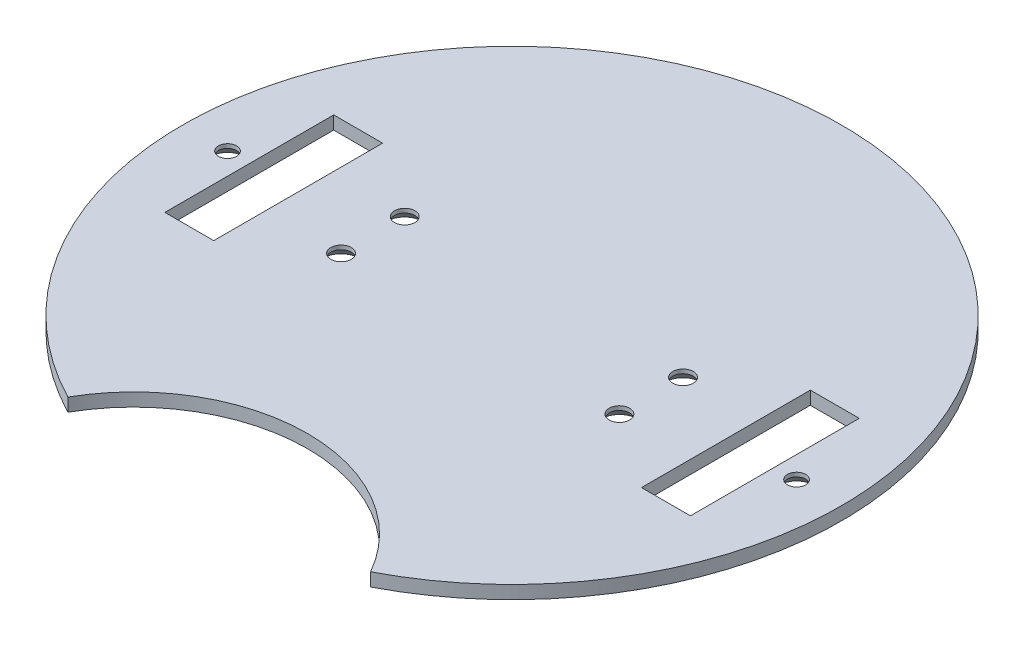
from build123d import *
from OCP.BRepFilletAPI import BRepFilletAPI_MakeChamfer

# Parameters (mm, degrees)
BOSS_EXTRUDE1_DEPTH = 2.9
SKETCH2_W           = 10.76
SKETCH2_H           = 37.139097212
CUT_EXTRUDE1_DEPTH  = 103.571487266
SKETCH3_R           = 2
SKETCH3_R_2         = 2.25
CUT_EXTRUDE2_DEPTH  = 103.571487266
CHAMFER1_SIZE       = 2
CHAMFER1_SIZE2      = 1.738573476


with BuildPart() as part:
    # Sketch1 → Boss-Extrude1 (new body)
    with BuildSketch(Plane(origin=(0, 0, 0), x_dir=(1, 0, 0), z_dir=(0, 1, 0))):
        with BuildLine():
            ThreePointArc((33.29110537, -64.404598464), (0, 72.5), (-33.29110537, -64.404598464))
            ThreePointArc((-33.29110537, -64.404598464), (0, -44.989799638), (33.29110537, -64.404598464))
        make_face()
    extrude(amount=BOSS_EXTRUDE1_DEPTH)

    # Sketch2 → Cut-Extrude1 (cut, through all)
    with BuildSketch(Plane(origin=(0, 2.9, 0), x_dir=(1, 0, 0), z_dir=(0, 1, 0))):
        with Locations((-52.42, 0)):
            Rectangle(SKETCH2_W, SKETCH2_H)
        with Locations((52.42, 0)):
            Rectangle(SKETCH2_W, SKETCH2_H)
    extrude(amount=-CUT_EXTRUDE1_DEPTH, mode=Mode.SUBTRACT)

    # Sketch3 → Cut-Extrude2 (cut, through all)
    with BuildSketch(Plane.XZ):
        with Locations((-62.58, 0)):
            Circle(SKETCH3_R)
        with Locations((-30.61, 7)):
            Circle(SKETCH3_R_2)
        with Locations((-30.61, -7)):
            Circle(SKETCH3_R_2)
        with Locations((30.61, -7)):
            Circle(SKETCH3_R_2)
        with Locations((30.61, 7)):
            Circle(SKETCH3_R_2)
        with Locations((62.58, 0)):
            Circle(SKETCH3_R)
    extrude(amount=-CUT_EXTRUDE2_DEPTH, mode=Mode.SUBTRACT)

    # Chamfer1: one chamfer whose edges measure the first distance from different faces: ONE call of the kernel's chamfer builder (chamfer() names one face for all edges)
    chamfer1_edges_1 = [part.edges().sort_by_distance(p)[0] for p in [
        (-32.86, 0, -7),
    ]]
    chamfer1_side_1 = [part.faces().sort_by_distance(p)[0] for p in [
        (-32.86, 1.45, -7),
    ]]
    chamfer1_edges_2 = [part.edges().sort_by_distance(p)[0] for p in [
        (-32.86, 0, 7),
    ]]
    chamfer1_side_2 = [part.faces().sort_by_distance(p)[0] for p in [
        (-32.86, 1.45, 7),
    ]]
    chamfer1_edges_3 = [part.edges().sort_by_distance(p)[0] for p in [
        (-64.58, 0, 0),
    ]]
    chamfer1_side_3 = [part.faces().sort_by_distance(p)[0] for p in [
        (-64.58, 1.45, 0),
    ]]
    chamfer1_edges_4 = [part.edges().sort_by_distance(p)[0] for p in [
        (60.58, 0, 0),
    ]]
    chamfer1_side_4 = [part.faces().sort_by_distance(p)[0] for p in [
        (60.58, 1.45, 0),
    ]]
    chamfer1_edges_5 = [part.edges().sort_by_distance(p)[0] for p in [
        (28.36, 0, 7),
    ]]
    chamfer1_side_5 = [part.faces().sort_by_distance(p)[0] for p in [
        (28.36, 1.45, 7),
    ]]
    chamfer1_edges_6 = [part.edges().sort_by_distance(p)[0] for p in [
        (28.36, 0, -7),
    ]]
    chamfer1_side_6 = [part.faces().sort_by_distance(p)[0] for p in [
        (28.36, 1.45, -7),
    ]]
    chamfer1 = BRepFilletAPI_MakeChamfer(part.part.solid().wrapped)
    for e in chamfer1_edges_1:
        chamfer1.Add(CHAMFER1_SIZE, CHAMFER1_SIZE2, e.wrapped, chamfer1_side_1[0].wrapped)  # the first distance lies on this face
    for e in chamfer1_edges_2:
        chamfer1.Add(CHAMFER1_SIZE, CHAMFER1_SIZE2, e.wrapped, chamfer1_side_2[0].wrapped)  # the first distance lies on this face
    for e in chamfer1_edges_3:
        chamfer1.Add(CHAMFER1_SIZE, CHAMFER1_SIZE2, e.wrapped, chamfer1_side_3[0].wrapped)  # the first distance lies on this face
    for e in chamfer1_edges_4:
        chamfer1.Add(CHAMFER1_SIZE, CHAMFER1_SIZE2, e.wrapped, chamfer1_side_4[0].wrapped)  # the first distance lies on this face
    for e in chamfer1_edges_5:
        chamfer1.Add(CHAMFER1_SIZE, CHAMFER1_SIZE2, e.wrapped, chamfer1_side_5[0].wrapped)  # the first distance lies on this face
    for e in chamfer1_edges_6:
        chamfer1.Add(CHAMFER1_SIZE, CHAMFER1_SIZE2, e.wrapped, chamfer1_side_6[0].wrapped)  # the first distance lies on this face
    add(Compound.cast(chamfer1.Shape()), mode=Mode.REPLACE)


solid = part.part
